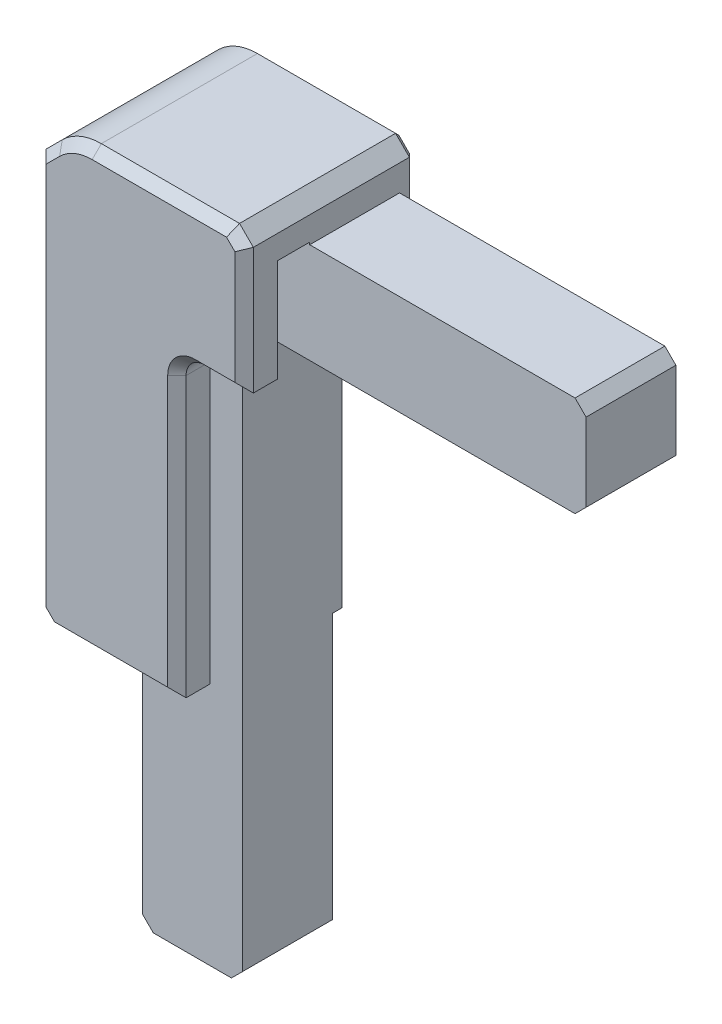
from build123d import *

# Parameters (mm, degrees)
BODY_DEPTH                   = 5.71
SIDE_TONGUE_SKETCH_W         = 10.88
SIDE_TONGUE_SKETCH_H         = 31
SIDE_TONGUE_DEPTH            = 4.875
END_TONGUE_SKETCH_W          = 31
END_TONGUE_SKETCH_H          = 10.88
END_TONGUE_DEPTH             = 4.875
WEB_DEPTH                    = 9.27
LIP_DEPTH                    = 1.81
BUMPER_CORNER_BED_SIDE_SIZE  = 3.516
BUMPER_CORNER_R              = 6
SHEET_CORNER_RELIEF_SKETCH_R = 1
SHEET_CORNER_RELIEF_DEPTH    = 1.75
REVEAL_CORNER_R              = 2
BODY_INSIDE_CORNER_R         = 2
ARM_ENDS_SIZE                = 1.5
TONGUE_LEAD_IN_SIZE          = 1.2
FRONT_FACE_CHAMFER_SIZE      = 1
BACK_FACE_CHAMFER_SIZE       = 0.6


with BuildPart() as part:
    # body sketch → body (new, symmetric)
    with BuildSketch(Plane.XY.offset(19.54)):
        Polygon((-4.42, 7.07), (18.08, 7.07), (18.08, -8.13), (10.78, -8.13), (10.78, -40.43), (-4.42, -40.43), align=None)
    extrude(amount=BODY_DEPTH, both=True)

    # side tongue sketch → side tongue (add, symmetric)
    with BuildSketch(Plane.XY.offset(20.375)):
        with Locations((5.34, -54.93)):
            Rectangle(SIDE_TONGUE_SKETCH_W, SIDE_TONGUE_SKETCH_H)
    extrude(amount=SIDE_TONGUE_DEPTH, both=True)

    # end tongue sketch → end tongue (add, symmetric)
    with BuildSketch(Plane.XY.offset(20.375)):
        with Locations((32.58, -2.69)):
            Rectangle(END_TONGUE_SKETCH_W, END_TONGUE_SKETCH_H)
    extrude(amount=END_TONGUE_DEPTH, both=True)

    # web sketch → web (add, symmetric)
    with BuildSketch(Plane.XY.offset(23.1)):
        Polygon((-4.42, 7.07), (18.08, 7.07), (18.08, 3), (-0.35, 3), (-0.35, -40.43), (-4.42, -40.43), align=None)
    extrude(amount=WEB_DEPTH, both=True)

    # lip sketch → lip (add, symmetric)
    with BuildSketch(Plane.XY.offset(30.56)):
        Polygon((-4.42, 7.07), (18.08, 7.07), (18.08, -8.13), (10.78, -8.13), (10.78, -40.43), (-4.42, -40.43), align=None)
    extrude(amount=LIP_DEPTH, both=True)

    # insert hole 1 sketch → insert hole 1 (revolve, cut)
    with BuildSketch(Plane.XY.offset(19.54)):
        Polygon((3.58, -28.7), (-5.42, -28.7), (-5.42, -24.530439128), (-4.02, -25.930439128), (1.98, -26.35), (3.58, -26.35), align=None)
    revolve(axis=Axis((3.58, -28.7, 19.54), (-1, 0, 0)), mode=Mode.SUBTRACT)

    # insert hole 2 sketch → insert hole 2 (revolve, cut)
    with BuildSketch(Plane.XY.offset(19.54)):
        Polygon((3.58, -12.7), (-5.42, -12.7), (-5.42, -8.530439128), (-4.02, -9.930439128), (1.98, -10.35), (3.58, -10.35), align=None)
    revolve(axis=Axis((3.58, -12.7, 19.54), (-1, 0, 0)), mode=Mode.SUBTRACT)

    # bumper corner, bed side
    bumper_corner_bed_side_edges = [part.edges().sort_by_distance(p)[0] for p in [
        (-4.42, 7.07, 23.1),
    ]]
    chamfer(bumper_corner_bed_side_edges, length=BUMPER_CORNER_BED_SIDE_SIZE)

    # bumper corner
    bumper_corner_edges = [part.edges().sort_by_distance(p)[0] for p in [
        (-0.904, 7.07, 23.1),
    ]]
    fillet(bumper_corner_edges, radius=BUMPER_CORNER_R)

    # sheet corner relief sketch → sheet corner relief (cut, symmetric)
    with BuildSketch(Plane.XY.offset(27)):
        with Locations((-0.35, 3)):
            Circle(SHEET_CORNER_RELIEF_SKETCH_R)
    extrude(amount=SHEET_CORNER_RELIEF_DEPTH, both=True, mode=Mode.SUBTRACT)

    # reveal corner
    reveal_corner_edges = [part.edges().sort_by_distance(p)[0] for p in [
        (10.78, -8.13, 30.56),
    ]]
    fillet(reveal_corner_edges, radius=REVEAL_CORNER_R)

    # body inside corner
    body_inside_corner_edges = [part.edges().sort_by_distance(p)[0] for p in [
        (10.78, -8.13, 19.54),
    ]]
    fillet(body_inside_corner_edges, radius=BODY_INSIDE_CORNER_R)

    # arm ends
    arm_ends_edges = [part.edges().sort_by_distance(p)[0] for p in [
        (18.08, 7.07, 23.1),
        (-4.42, -40.43, 23.1),
    ]]
    chamfer(arm_ends_edges, length=ARM_ENDS_SIZE)

    # tongue lead-in
    tongue_lead_in_edges = [part.edges().sort_by_distance(p)[0] for p in [
        (48.08, -8.13, 20.375),
        (48.08, 2.75, 20.375),
        (10.78, -70.43, 20.375),
        (-0.1, -70.43, 20.375),
    ]]
    chamfer(tongue_lead_in_edges, length=TONGUE_LEAD_IN_SIZE)

    # front face chamfer
    front_face_chamfer_edges = [part.edges().sort_by_distance(p)[0] for p in [
        (15.43, -8.13, 32.37),
        (11.365786438, -8.715786438, 32.37),
        (10.78, -25.28, 32.37),
        (3.93, -40.43, 32.37),
        (-3.67, -39.68, 32.37),
        (-4.42, -17.688, 32.37),
        (-3.540679656, 4.433320344, 32.37),
        (-0.71481922, 6.613277195, 32.37),
        (9.080640687, 7.07, 32.37),
        (17.33, 6.32, 32.37),
        (18.08, -1.28, 32.37),
    ]]
    chamfer(front_face_chamfer_edges, length=FRONT_FACE_CHAMFER_SIZE)

    # back face chamfer
    back_face_chamfer_edges = [part.edges().sort_by_distance(p)[0] for p in [
        (-0.71481922, 6.613277195, 13.83),
        (-3.540679656, 4.433320344, 13.83),
        (-4.42, -17.688, 13.83),
        (-3.67, -39.68, 13.83),
        (3.93, -40.43, 13.83),
        (10.78, -25.28, 13.83),
        (11.365786438, -8.715786438, 13.83),
        (15.43, -8.13, 13.83),
        (18.08, -1.28, 13.83),
        (17.33, 6.32, 13.83),
        (9.080640687, 7.07, 13.83),
    ]]
    chamfer(back_face_chamfer_edges, length=BACK_FACE_CHAMFER_SIZE)


solid = part.part
